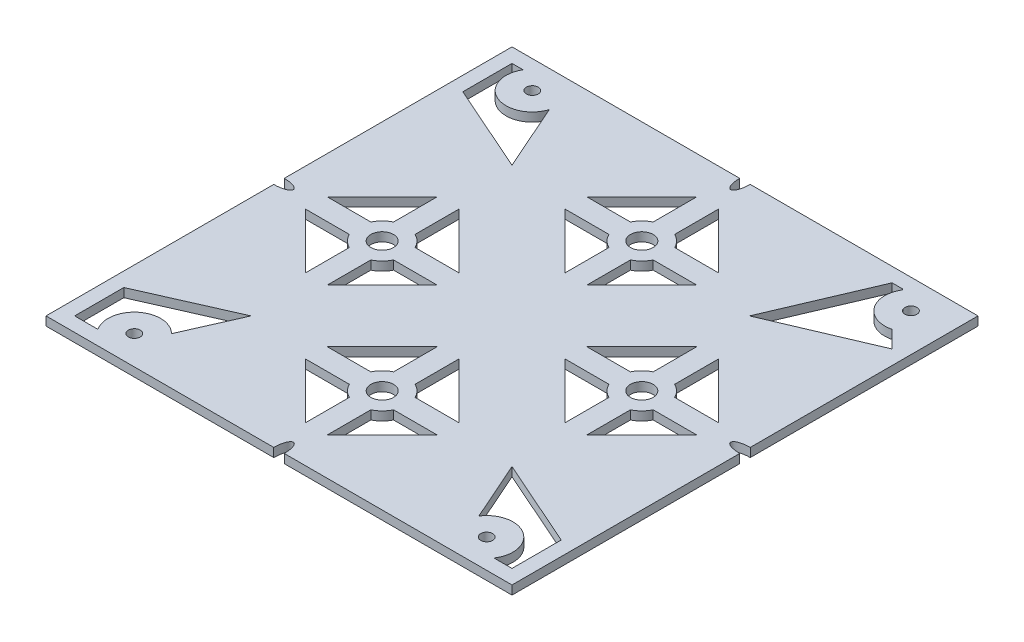
from build123d import *

# Parameters (mm, degrees)
SKETCH1_W           = 97.6
SKETCH1_H           = 97.6
BOSS_EXTRUDE1_DEPTH = 1.85
SKETCH3_R           = 1.25
CUT_EXTRUDE1_DEPTH  = 10
FILLET1_R           = 0.2
SKETCH5_R           = 2.375
CUT_EXTRUDE2_DEPTH  = 10


with BuildPart() as part:
    # Sketch1 → Boss-Extrude1 (new body)
    with BuildSketch(Plane(origin=(0, 0, 0), x_dir=(1, 0, 0), z_dir=(0, 1, 0))):
        with Locations((48.8, 48.8)):
            Rectangle(SKETCH1_W, SKETCH1_H)
    extrude(amount=BOSS_EXTRUDE1_DEPTH)

    # Sketch3 → Cut-Extrude1 (cut)
    with BuildSketch(Plane.XZ):
        with BuildLine():
            Line((3, -84.3), (3, -94.6))
            Line((3, -94.6), (5.316079849, -94.6))
            ThreePointArc((5.316079849, -94.6), (7.792729855, -86.784550719), (15.285000001, -90.113353923))
            Line((15.285000001, -90.113353923), (21.472818771, -76.127181229))
            Line((21.472818771, -76.127181229), (3, -84.3))
        make_face()
        with BuildLine():
            Line((3, -13.3), (21.472818771, -21.472818771))
            Line((21.472818771, -21.472818771), (16.360495139, -9.917560959))
            ThreePointArc((16.360495139, -9.917560959), (8.975209709, -10.313312378), (7.873156109, -3))
            Line((7.873156109, -3), (3, -3))
            Line((3, -3), (3, -13.3))
        make_face()
        with BuildLine():
            Line((94.6, -13.3), (94.6, -3))
            Line((94.6, -3), (90.826843891, -3))
            ThreePointArc((90.826843891, -3), (89.267333256, -10.648445392), (81.630186258, -9.034513526))
            Line((81.630186258, -9.034513526), (76.127181229, -21.472818771))
            Line((76.127181229, -21.472818771), (94.6, -13.3))
        make_face()
        with BuildLine():
            Line((91.027327292, -86.172672708), (94.6, -82.6))
            Line((94.6, -82.6), (73.674141566, -73.674141566))
            Line((73.674141566, -73.674141566), (82.6, -94.6))
            Line((82.6, -94.6), (85.116873323, -94.6))
            ThreePointArc((85.116873323, -94.6), (85.157069093, -88.341897208), (91.027327292, -86.172672708))
        make_face()
        with Locations((89.66, -91.5)):
            Circle(SKETCH3_R)
        with Locations((10.05, -91.8)):
            Circle(SKETCH3_R)
        with Locations((12.45, -6.05)):
            Circle(SKETCH3_R)
        with Locations((86.25, -6.05)):
            Circle(SKETCH3_R)
    extrude(amount=-CUT_EXTRUDE1_DEPTH, mode=Mode.SUBTRACT)

    # Fillet1
    fillet1_edges = [part.edges().sort_by_distance(p)[0] for p in [
        (85.116873323, 0.925, -94.6),
    ]]
    fillet(fillet1_edges, radius=FILLET1_R)

    # Sketch5 → Cut-Extrude2 (cut)
    with BuildSketch(Plane.XZ):
        with BuildLine():
            Line((51.05, -80.617052601), (51.05, -89.767052601))
            Line((51.05, -89.767052601), (62.582493929, -78.234558673))
            Line((62.582493929, -78.234558673), (53.432493929, -78.234558673))
            ThreePointArc((53.432493929, -78.234558673), (52.441599923, -79.626158596), (51.05, -80.617052601))
        make_face()
        with BuildLine():
            Line((46.55, -89.767052601), (46.55, -80.617052601))
            ThreePointArc((46.55, -80.617052601), (45.158400077, -79.626158596), (44.167506071, -78.234558673))
            Line((44.167506071, -78.234558673), (35.017506071, -78.234558673))
            Line((35.017506071, -78.234558673), (46.55, -89.767052601))
        make_face()
        with BuildLine():
            Line((35.017506071, -73.734558673), (44.167506071, -73.734558673))
            ThreePointArc((44.167506071, -73.734558673), (45.158400077, -72.34295875), (46.55, -71.352064744))
            Line((46.55, -71.352064744), (46.55, -62.202064744))
            Line((46.55, -62.202064744), (35.017506071, -73.734558673))
        make_face()
        with BuildLine():
            ThreePointArc((51.05, -71.352064744), (52.441599923, -72.34295875), (53.432493929, -73.734558673))
            Line((53.432493929, -73.734558673), (62.582493929, -73.734558673))
            Line((62.582493929, -73.734558673), (51.05, -62.202064744))
            Line((51.05, -62.202064744), (51.05, -71.352064744))
        make_face()
        with BuildLine():
            Line((73.734558673, -35.017506071), (62.202064744, -46.55))
            Line((62.202064744, -46.55), (71.352064744, -46.55))
            ThreePointArc((71.352064744, -46.55), (72.34295875, -45.158400077), (73.734558673, -44.167506071))
            Line((73.734558673, -44.167506071), (73.734558673, -35.017506071))
        make_face()
        with BuildLine():
            ThreePointArc((73.734558673, -53.432493929), (72.34295875, -52.441599923), (71.352064744, -51.05))
            Line((71.352064744, -51.05), (62.202064744, -51.05))
            Line((62.202064744, -51.05), (73.734558673, -62.582493929))
            Line((73.734558673, -62.582493929), (73.734558673, -53.432493929))
        make_face()
        with BuildLine():
            Line((78.234558673, -35.017506071), (78.234558673, -44.167506071))
            ThreePointArc((78.234558673, -44.167506071), (79.626158596, -45.158400077), (80.617052601, -46.55))
            Line((80.617052601, -46.55), (89.767052601, -46.55))
            Line((89.767052601, -46.55), (78.234558673, -35.017506071))
        make_face()
        with BuildLine():
            ThreePointArc((80.617052601, -51.05), (79.626158596, -52.441599923), (78.234558673, -53.432493929))
            Line((78.234558673, -53.432493929), (78.234558673, -62.582493929))
            Line((78.234558673, -62.582493929), (89.767052601, -51.05))
            Line((89.767052601, -51.05), (80.617052601, -51.05))
        make_face()
        with BuildLine():
            Line((46.55, -16.982947399), (46.55, -7.832947399))
            Line((46.55, -7.832947399), (35.017506071, -19.365441327))
            Line((35.017506071, -19.365441327), (44.167506071, -19.365441327))
            ThreePointArc((44.167506071, -19.365441327), (45.158400077, -17.973841404), (46.55, -16.982947399))
        make_face()
        with BuildLine():
            Line((51.05, -7.832947399), (51.05, -16.982947399))
            ThreePointArc((51.05, -16.982947399), (52.441599923, -17.973841404), (53.432493929, -19.365441327))
            Line((53.432493929, -19.365441327), (62.582493929, -19.365441327))
            Line((62.582493929, -19.365441327), (51.05, -7.832947399))
        make_face()
        with BuildLine():
            ThreePointArc((46.55, -26.247935256), (45.158400077, -25.25704125), (44.167506071, -23.865441327))
            Line((44.167506071, -23.865441327), (35.017506071, -23.865441327))
            Line((35.017506071, -23.865441327), (46.55, -35.397935256))
            Line((46.55, -35.397935256), (46.55, -26.247935256))
        make_face()
        with BuildLine():
            Line((62.582493929, -23.865441327), (53.432493929, -23.865441327))
            ThreePointArc((53.432493929, -23.865441327), (52.441599923, -25.25704125), (51.05, -26.247935256))
            Line((51.05, -26.247935256), (51.05, -35.397935256))
            Line((51.05, -35.397935256), (62.582493929, -23.865441327))
        make_face()
        with BuildLine():
            Line((23.865441327, -62.582493929), (35.397935256, -51.05))
            Line((35.397935256, -51.05), (26.247935256, -51.05))
            ThreePointArc((26.247935256, -51.05), (25.25704125, -52.441599923), (23.865441327, -53.432493929))
            Line((23.865441327, -53.432493929), (23.865441327, -62.582493929))
        make_face()
        with BuildLine():
            Line((19.365441327, -62.582493929), (19.365441327, -53.432493929))
            ThreePointArc((19.365441327, -53.432493929), (17.973841404, -52.441599923), (16.982947399, -51.05))
            Line((16.982947399, -51.05), (7.832947399, -51.05))
            Line((7.832947399, -51.05), (19.365441327, -62.582493929))
        make_face()
        with BuildLine():
            ThreePointArc((23.865441327, -44.167506071), (25.25704125, -45.158400077), (26.247935256, -46.55))
            Line((26.247935256, -46.55), (35.397935256, -46.55))
            Line((35.397935256, -46.55), (23.865441327, -35.017506071))
            Line((23.865441327, -35.017506071), (23.865441327, -44.167506071))
        make_face()
        with BuildLine():
            Line((7.832947399, -46.55), (16.982947399, -46.55))
            ThreePointArc((16.982947399, -46.55), (17.973841404, -45.158400077), (19.365441327, -44.167506071))
            Line((19.365441327, -44.167506071), (19.365441327, -35.017506071))
            Line((19.365441327, -35.017506071), (7.832947399, -46.55))
        make_face()
        with BuildLine():
            Line((47.7, -97.6), (49.9, -97.6))
            add(Edge.make_bspline(
                [(49.9, -97.6), (49.9, -94.604595373), (48.8, -94.604595373)],
                knots=[4.71238898, 4.71238898, 4.71238898, 6.283185307, 6.283185307, 6.283185307], degree=2, weights=[1, 0.707106781, 1]))
            add(Edge.make_bspline(
                [(48.8, -94.604595373), (47.7, -94.604595373), (47.7, -97.6)],
                knots=[0, 0, 0, 1.570796327, 1.570796327, 1.570796327], degree=2, weights=[1, 0.707106781, 1]))
        make_face()
        with BuildLine():
            add(Edge.make_bspline(
                [(94.596161078, -48.8), (94.596161078, -49.9), (97.6, -49.9)],
                knots=[0, 0, 0, 1.570796327, 1.570796327, 1.570796327], degree=2, weights=[1, 0.707106781, 1]))
            Line((97.6, -49.9), (97.6, -47.7))
            add(Edge.make_bspline(
                [(97.6, -47.7), (94.596161078, -47.7), (94.596161078, -48.8)],
                knots=[4.71238898, 4.71238898, 4.71238898, 6.283185307, 6.283185307, 6.283185307], degree=2, weights=[1, 0.707106781, 1]))
        make_face()
        with BuildLine():
            Line((0, -47.7), (0, -49.9))
            add(Edge.make_bspline(
                [(0, -49.9), (3, -49.9), (3, -48.8)],
                knots=[4.71238898, 4.71238898, 4.71238898, 6.283185307, 6.283185307, 6.283185307], degree=2, weights=[1, 0.707106781, 1]))
            add(Edge.make_bspline(
                [(3, -48.8), (3, -47.7), (0, -47.7)],
                knots=[0, 0, 0, 1.570796327, 1.570796327, 1.570796327], degree=2, weights=[1, 0.707106781, 1]))
        make_face()
        with BuildLine():
            add(Edge.make_bspline(
                [(48.8, -3), (49.9, -3), (49.9, 0)],
                knots=[0, 0, 0, 1.570796327, 1.570796327, 1.570796327], degree=2, weights=[1, 0.707106781, 1]))
            Line((49.9, 0), (47.7, 0))
            add(Edge.make_bspline(
                [(47.7, 0), (47.7, -3), (48.8, -3)],
                knots=[4.71238898, 4.71238898, 4.71238898, 6.283185307, 6.283185307, 6.283185307], degree=2, weights=[1, 0.707106781, 1]))
        make_face()
        with Locations((48.8, -75.984558673)):
            Circle(SKETCH5_R)
        with Locations((75.984558673, -48.8)):
            Circle(SKETCH5_R)
        with Locations((48.8, -21.615441327)):
            Circle(SKETCH5_R)
        with Locations((21.615441327, -48.8)):
            Circle(SKETCH5_R)
    extrude(amount=-CUT_EXTRUDE2_DEPTH, mode=Mode.SUBTRACT)


solid = part.part
